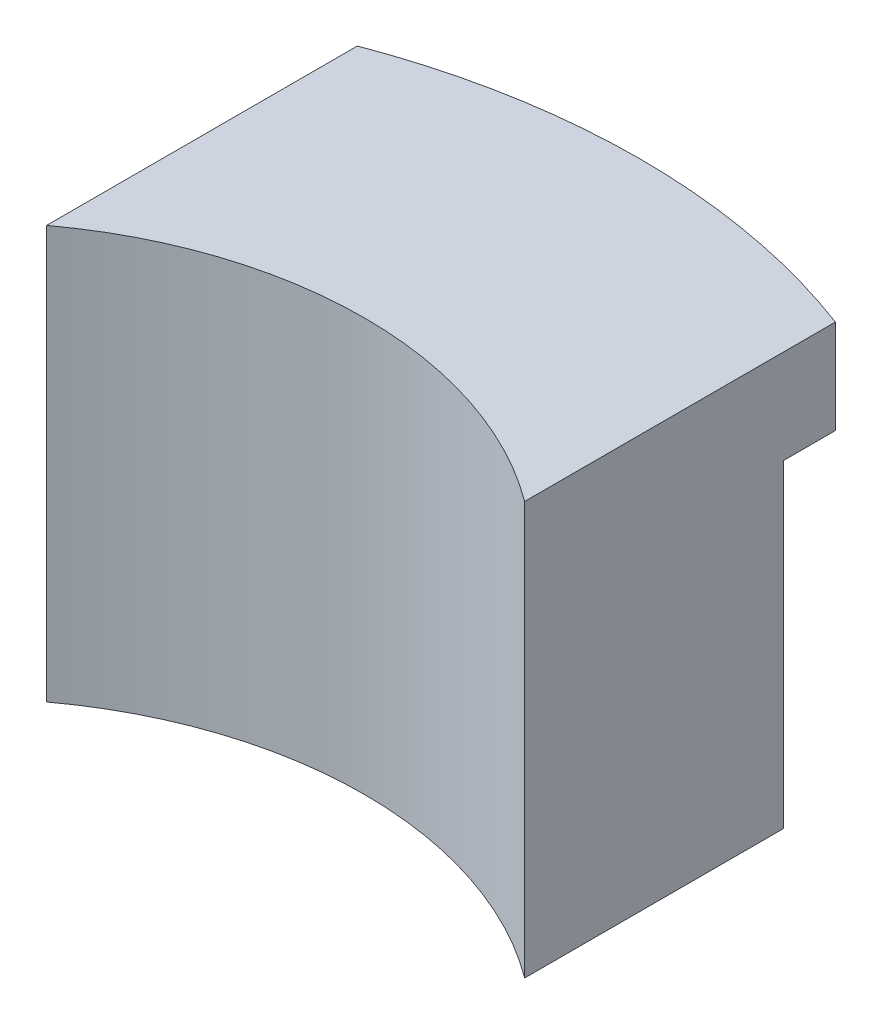
from build123d import *

# Parameters (mm, degrees)
BOSS_EXTRUDE2_DEPTH  = 2
BOSS_EXTRUDE9_START  = 3
BOSS_EXTRUDE9_DEPTH  = 3
BOSS_EXTRUDE10_START = 0.9
BOSS_EXTRUDE10_DEPTH = 0.9
SKETCH20_R           = 3.25
CUT_EXTRUDE14_DEPTH  = 20.9
SKETCH21_W           = 30
SKETCH21_H           = 16.85185618
CUT_EXTRUDE15_DEPTH  = 1
BOSS_EXTRUDE11_START = 20
BOSS_EXTRUDE11_DEPTH = 20
SKETCH23_W           = 0.5
SKETCH23_H           = 19.1
BOSS_EXTRUDE12_DEPTH = 0.9
BOSS_EXTRUDE13_START = 0.9
BOSS_EXTRUDE13_DEPTH = 0.9


with BuildPart() as part:
    # Sketch1 → Boss-Extrude2 (new body)
    with BuildSketch(Plane(origin=(0, 0, 0), x_dir=(1, 0, 0), z_dir=(0, 1, 0))):
        with BuildLine():
            Line((-15, 39.764934301), (-15, 20.264934301))
            ThreePointArc((-15, 20.264934301), (0, 25.212448557), (15, 20.264934301))
            Line((15, 20.264934301), (15, 39.764934301))
            ThreePointArc((15, 39.764934301), (0, 42.5), (-15, 39.764934301))
        make_face()
    extrude(amount=BOSS_EXTRUDE2_DEPTH)

    # Sketch16 → Boss-Extrude9 (add)
    with BuildSketch(Plane.XZ.offset(BOSS_EXTRUDE9_START)):
        with BuildLine():
            ThreePointArc((15, -20.264934301), (0, -25.212448557), (-15, -20.264934301))
            Line((-15, -20.264934301), (-15, -39.764934301))
            ThreePointArc((-15, -39.764934301), (0, -42.5), (15, -39.764934301))
            Line((15, -39.764934301), (15, -20.264934301))
        make_face()
        with BuildLine():
            Line((-13, -38.356876828), (-13, -23.906429187))
            ThreePointArc((-13, -23.906429187), (0, -27.212448557), (13, -23.906429187))
            Line((13, -23.906429187), (13, -38.356876828))
            ThreePointArc((13, -38.356876828), (0, -40.5), (-13, -38.356876828))
        make_face(mode=Mode.SUBTRACT)
    extrude(amount=-BOSS_EXTRUDE9_DEPTH)

    # Sketch17 → Boss-Extrude10 (add)
    with BuildSketch(Plane.XZ.offset(3).offset(BOSS_EXTRUDE10_START)):
        with BuildLine():
            ThreePointArc((15, -20.264934301), (0, -25.212448557), (-15, -20.264934301))
            Line((-15, -20.264934301), (-15, -39.764934301))
            ThreePointArc((-15, -39.764934301), (0, -42.5), (15, -39.764934301))
            Line((15, -39.764934301), (15, -20.264934301))
        make_face()
        with BuildLine():
            Line((-14.5, -39.417635647), (-14.5, -21.233935358))
            ThreePointArc((-14.5, -21.233935358), (0, -25.712448557), (14.5, -21.233935358))
            Line((14.5, -21.233935358), (14.5, -39.417635647))
            ThreePointArc((14.5, -39.417635647), (0, -42), (-14.5, -39.417635647))
        make_face(mode=Mode.SUBTRACT)
    extrude(amount=-BOSS_EXTRUDE10_DEPTH)

    # Sketch20 → Cut-Extrude14 (cut)
    with BuildSketch(Plane.XY.offset(-50)):
        with Locations((0, -3.9)):
            Circle(SKETCH20_R)
    extrude(amount=CUT_EXTRUDE14_DEPTH, mode=Mode.SUBTRACT)

    # Sketch21 → Cut-Extrude15 (cut)
    with BuildSketch(Plane.XZ.offset(3)):
        with Locations((0, -27.189006211)):
            Rectangle(SKETCH21_W, SKETCH21_H)
    extrude(amount=CUT_EXTRUDE15_DEPTH, mode=Mode.SUBTRACT)

    # Sketch22 → Boss-Extrude11 (add)
    with BuildSketch(Plane.XZ.offset(3).offset(BOSS_EXTRUDE11_START)):
        with BuildLine():
            Line((15, -20.264934301), (15, -35.614934301))
            Line((15, -35.614934301), (13, -35.614934301))
            Line((13, -35.614934301), (13, -23.906429187))
            ThreePointArc((13, -23.906429187), (0, -27.212448557), (-13, -23.906429187))
            Line((-13, -23.906429187), (-13, -35.614934301))
            Line((-13, -35.614934301), (-15, -35.614934301))
            Line((-15, -35.614934301), (-15, -20.264934301))
            ThreePointArc((-15, -20.264934301), (0, -25.212448557), (15, -20.264934301))
        make_face()
    extrude(amount=-BOSS_EXTRUDE11_DEPTH)

    # Sketch23 → Boss-Extrude12 (add)
    with BuildSketch(Plane(origin=(0, 0, -35.614934301), x_dir=(-1, 0, 0), z_dir=(0, 0, -1))):
        with Locations((-14.75, -13.45)):
            Rectangle(SKETCH23_W, SKETCH23_H)
        with Locations((14.75, -13.45)):
            Rectangle(SKETCH23_W, SKETCH23_H)
    extrude(amount=BOSS_EXTRUDE12_DEPTH)

    # Sketch26 → Boss-Extrude13 (add)
    with BuildSketch(Plane.XZ.offset(23).offset(BOSS_EXTRUDE13_START)):
        with BuildLine():
            Line((15, -36.514934301), (15, -20.264934301))
            ThreePointArc((15, -20.264934301), (0, -25.212448557), (-15, -20.264934301))
            Line((-15, -20.264934301), (-15, -36.514934301))
            Line((-15, -36.514934301), (-14.5, -36.514934301))
            Line((-14.5, -36.514934301), (-14.5, -21.233935358))
            ThreePointArc((-14.5, -21.233935358), (0, -25.712448557), (14.5, -21.233935358))
            Line((14.5, -21.233935358), (14.5, -36.514934301))
            Line((14.5, -36.514934301), (15, -36.514934301))
        make_face()
    extrude(amount=-BOSS_EXTRUDE13_DEPTH)


solid = part.part
